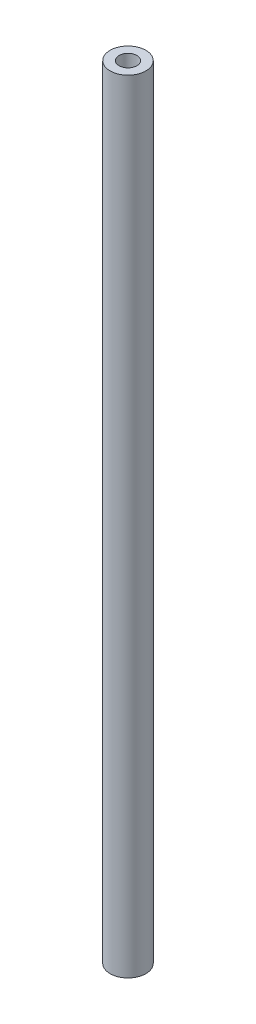
from build123d import *

# Parameters (mm, degrees)
SKETCH1_R           = 4
BOSS_EXTRUDE1_DEPTH = 175
SKETCH2_R           = 2
CUT_EXTRUDE1_DEPTH  = 30


with BuildPart() as part:
    # Sketch1 → Boss-Extrude1 (new body)
    with BuildSketch(Plane(origin=(0, 0, 0), x_dir=(1, 0, 0), z_dir=(0, 1, 0))):
        Circle(SKETCH1_R)
    extrude(amount=BOSS_EXTRUDE1_DEPTH)

    # Sketch2 → Cut-Extrude1 (cut)
    with BuildSketch(Plane.XZ):
        Circle(SKETCH2_R)
    cut_extrude1 = extrude(amount=-CUT_EXTRUDE1_DEPTH, mode=Mode.SUBTRACT)

    # Mirror1: Cut-Extrude1 across plane
    add(cut_extrude1.mirror(Plane(origin=(0, 87.5, 0), x_dir=(0, 0, 1), z_dir=(0, -1, 0))), mode=Mode.SUBTRACT)


solid = part.part
